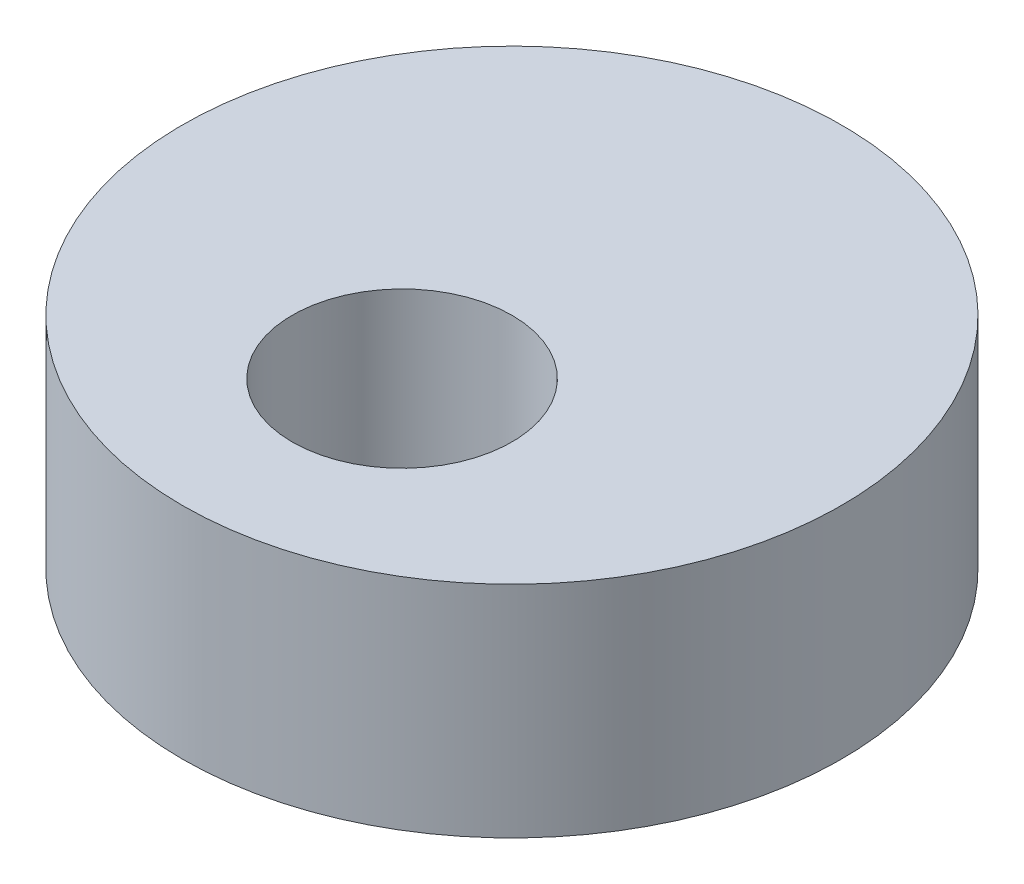
from build123d import *

# Parameters (mm, degrees)
SKETCH1_R           = 9.525
SKETCH1_R_2         = 3.175
BOSS_EXTRUDE1_DEPTH = 6.35


with BuildPart() as part:
    # Sketch1 → Boss-Extrude1 (new body)
    with BuildSketch(Plane(origin=(0, 0, 0), x_dir=(1, 0, 0), z_dir=(0, 1, 0))):
        Circle(SKETCH1_R)
        with Locations((0, -3.175)):
            Circle(SKETCH1_R_2, mode=Mode.SUBTRACT)
    extrude(amount=BOSS_EXTRUDE1_DEPTH)


solid = part.part
